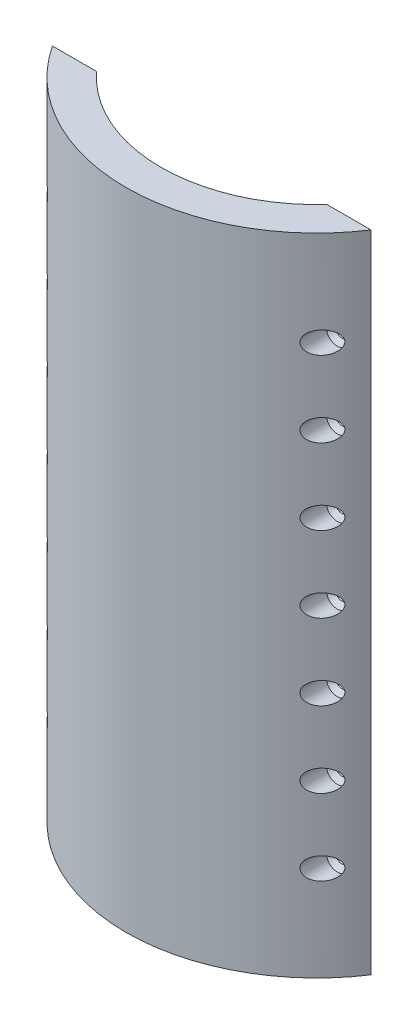
from build123d import *

# Parameters (mm, degrees)
BOSS_EXTRUDE1_DEPTH = 170
LPATTERN1_COUNT     = 7
LPATTERN1_PITCH     = 20


with BuildPart() as part:
    # Sketch1 → Boss-Extrude1 (new body)
    with BuildSketch(Plane(origin=(60.535204745, 0, -85.948449604), x_dir=(1, 0, 0), z_dir=(0, 1, 0))):
        with BuildLine():
            ThreePointArc((-30.186446753, -113.644462538), (-60.535204745, -127.035141416), (-90.883962736, -113.644462538))
            Line((-90.883962736, -113.644462538), (-102.513962844, -113.644462538))
            ThreePointArc((-102.513962844, -113.644462538), (-60.535204745, -136.240449604), (-18.556446645, -113.644462538))
            Line((-18.556446645, -113.644462538), (-30.186446753, -113.644462538))
        make_face()
    extrude(amount=BOSS_EXTRUDE1_DEPTH)

    # Sketch6 → Cut-Revolve4 (revolve, cut)
    with BuildSketch(Plane(origin=(36.163758045, 25, 27.696012934), x_dir=(-1, 0, 0), z_dir=(0, -1, 0))):
        Polygon((0, 1.685394277), (0, -4.78184701), (0, -15.185924704), (-2.9, -15.185924704), (-2.9, -3.079025683), (-1.65, -1.881964943), (-1.65, 1.685394277), align=None)
    cut_revolve4 = revolve(axis=Axis((36.163758045, 25, 26.010618657), (0, 0, 1)), mode=Mode.SUBTRACT)

    # LPattern1: Cut-Revolve4 ×7
    with Locations(*[(0, i * LPATTERN1_PITCH, 0) for i in range(1, LPATTERN1_COUNT)]):
        add(cut_revolve4, mode=Mode.SUBTRACT)

    # Mirror1: Cut-Revolve4 across plane
    add(cut_revolve4.mirror(Plane(origin=(0, 0, 0), x_dir=(0, 0, 1), z_dir=(1, 0, 0))), mode=Mode.SUBTRACT)

    # Mirror1 copy 1 sketch → Mirror1 copy 1 (revolve, cut)
    with BuildSketch(Plane(origin=(-36.163758045, 45, 27.696012934), x_dir=(1, 0, 0), z_dir=(0, -1, 0))):
        Polygon((0, -1.685394277), (0, 4.78184701), (0, 15.185924704), (-2.9, 15.185924704), (-2.9, 3.079025683), (-1.65, 1.881964943), (-1.65, -1.685394277), align=None)
    revolve(axis=Axis((-36.163758045, 45, 26.010618657), (0, 0, -1)), mode=Mode.SUBTRACT)

    # Mirror1 copy 2 sketch → Mirror1 copy 2 (revolve, cut)
    with BuildSketch(Plane(origin=(-36.163758045, 65, 27.696012934), x_dir=(1, 0, 0), z_dir=(0, -1, 0))):
        Polygon((0, -1.685394277), (0, 4.78184701), (0, 15.185924704), (-2.9, 15.185924704), (-2.9, 3.079025683), (-1.65, 1.881964943), (-1.65, -1.685394277), align=None)
    revolve(axis=Axis((-36.163758045, 65, 26.010618657), (0, 0, -1)), mode=Mode.SUBTRACT)

    # Mirror1 copy 3 sketch → Mirror1 copy 3 (revolve, cut)
    with BuildSketch(Plane(origin=(-36.163758045, 85, 27.696012934), x_dir=(1, 0, 0), z_dir=(0, -1, 0))):
        Polygon((0, -1.685394277), (0, 4.78184701), (0, 15.185924704), (-2.9, 15.185924704), (-2.9, 3.079025683), (-1.65, 1.881964943), (-1.65, -1.685394277), align=None)
    revolve(axis=Axis((-36.163758045, 85, 26.010618657), (0, 0, -1)), mode=Mode.SUBTRACT)

    # Mirror1 copy 4 sketch → Mirror1 copy 4 (revolve, cut)
    with BuildSketch(Plane(origin=(-36.163758045, 105, 27.696012934), x_dir=(1, 0, 0), z_dir=(0, -1, 0))):
        Polygon((0, -1.685394277), (0, 4.78184701), (0, 15.185924704), (-2.9, 15.185924704), (-2.9, 3.079025683), (-1.65, 1.881964943), (-1.65, -1.685394277), align=None)
    revolve(axis=Axis((-36.163758045, 105, 26.010618657), (0, 0, -1)), mode=Mode.SUBTRACT)

    # Mirror1 copy 5 sketch → Mirror1 copy 5 (revolve, cut)
    with BuildSketch(Plane(origin=(-36.163758045, 125, 27.696012934), x_dir=(1, 0, 0), z_dir=(0, -1, 0))):
        Polygon((0, -1.685394277), (0, 4.78184701), (0, 15.185924704), (-2.9, 15.185924704), (-2.9, 3.079025683), (-1.65, 1.881964943), (-1.65, -1.685394277), align=None)
    revolve(axis=Axis((-36.163758045, 125, 26.010618657), (0, 0, -1)), mode=Mode.SUBTRACT)

    # Mirror1 copy 6 sketch → Mirror1 copy 6 (revolve, cut)
    with BuildSketch(Plane(origin=(-36.163758045, 145, 27.696012934), x_dir=(1, 0, 0), z_dir=(0, -1, 0))):
        Polygon((0, -1.685394277), (0, 4.78184701), (0, 15.185924704), (-2.9, 15.185924704), (-2.9, 3.079025683), (-1.65, 1.881964943), (-1.65, -1.685394277), align=None)
    revolve(axis=Axis((-36.163758045, 145, 26.010618657), (0, 0, -1)), mode=Mode.SUBTRACT)


solid = part.part
